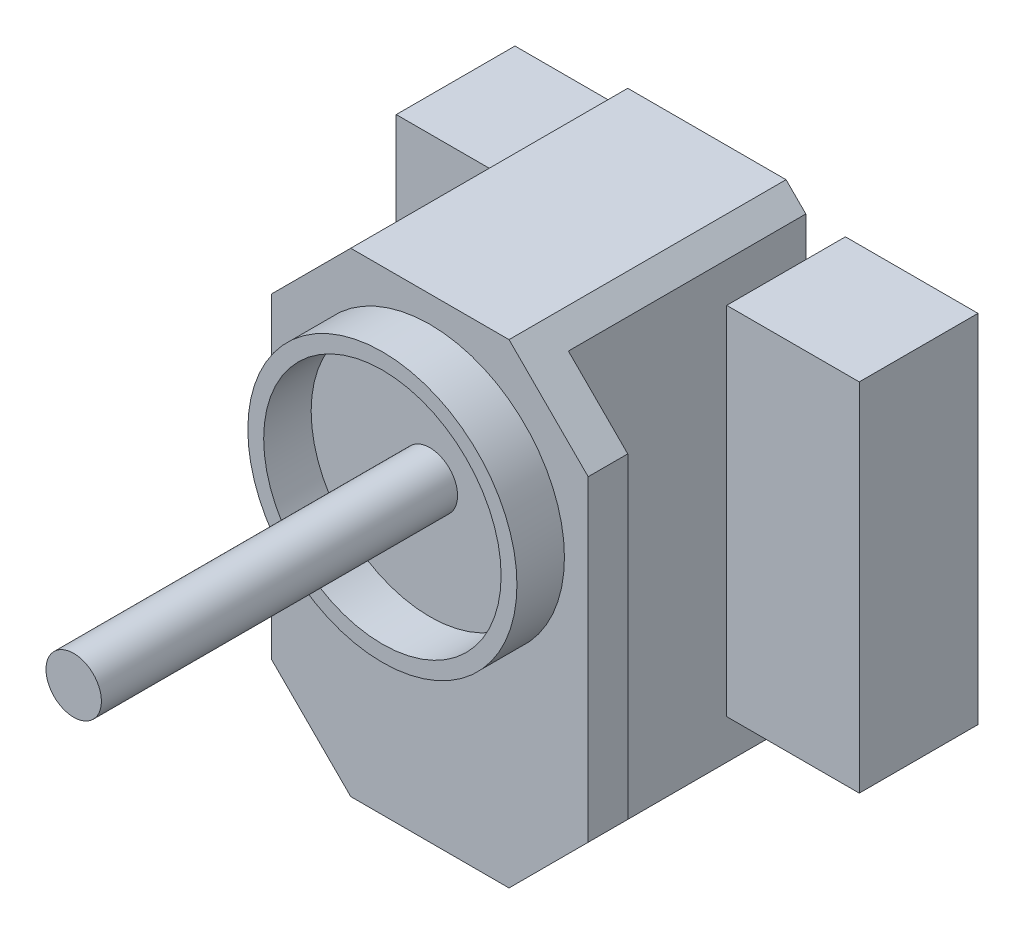
from build123d import *

# Parameters (mm, degrees)
SKETCH_1_W          = 25
SKETCH_1_H          = 60
EXTRUDE_1_DEPTH     = 35
SKETCH_2_W          = 20
SKETCH_2_H          = 40.5
CUT_EXTRUDE_1_DEPTH = 31.5
SKETCH_5_W          = 40
SKETCH_5_H          = 60
EXTRUDE_4_DEPTH     = 5
SKETCH_6_R          = 1.65
CUT_EXTRUDE_2_DEPTH = 6
SKETCH_10_W         = 15
SKETCH_10_H         = 45
EXTRUDE_7_DEPTH     = 16.75
SKETCH_18_R         = 1.25
CUT_EXTRUDE_4_DEPTH = 5
CUT_EXTRUDE_START   = -4
SKETCH_17_R         = 1.65
CUT_EXTRUDE_3_DEPTH = 12
SKETCH_13_R         = 3.5
EXTRUDE_10_DEPTH    = 45
SKETCH_15_R         = 17
SKETCH_15_R_2       = 15
EXTRUDE_11_DEPTH    = 6
CHAMFER_START       = 30
CHAMFER_3_DEPTH     = 5
CHAMFER_START_2     = -1
CHAMFER_3_2_DEPTH   = 31


with BuildPart() as part:
    # 草圖1 → 填料-伸長1 (new body)
    with BuildSketch(Plane.XY):
        Rectangle(SKETCH_1_W, SKETCH_1_H)
    extrude(amount=EXTRUDE_1_DEPTH)

    # 草圖2 → 除料-伸長1 (cut)
    with BuildSketch(Plane(origin=(0, 0, 0), x_dir=(-1, 0, 0), z_dir=(0, 0, -1))):
        Rectangle(SKETCH_2_W, SKETCH_2_H)
    extrude(amount=-CUT_EXTRUDE_1_DEPTH, mode=Mode.SUBTRACT)

    # 草圖5 → 填料-伸長4 (add)
    with BuildSketch(Plane.XY.offset(35)):
        Rectangle(SKETCH_5_W, SKETCH_5_H)
    extrude(amount=-EXTRUDE_4_DEPTH)

    # 草圖6 → 除料-伸長2 (cut)
    with BuildSketch(Plane(origin=(0, 0, 0), x_dir=(-1, 0, 0), z_dir=(0, 0, -1))):
        with Locations((5, 24.75)):
            Circle(SKETCH_6_R)
        with Locations((-5, 24.75)):
            Circle(SKETCH_6_R)
        with Locations((-5, -24.75)):
            Circle(SKETCH_6_R)
        with Locations((5, -24.75)):
            Circle(SKETCH_6_R)
    extrude(amount=-CUT_EXTRUDE_2_DEPTH, mode=Mode.SUBTRACT)

    # 草圖10 → 填料-伸長7 (add)
    with BuildSketch(Plane.ZY.offset(12.5)):
        with Locations((2.5, 0)):
            Rectangle(SKETCH_10_W, SKETCH_10_H)
    extrude_7 = extrude(amount=EXTRUDE_7_DEPTH)

    # 草圖18 → 除料-伸長4 (cut)
    with BuildSketch(Plane(origin=(0, 0, -5), x_dir=(-1, 0, 0), z_dir=(0, 0, -1))):
        with Locations((16, -20)):
            Circle(SKETCH_18_R)
        with Locations((16, 20)):
            Circle(SKETCH_18_R)
    cut_extrude_4 = extrude(amount=-CUT_EXTRUDE_4_DEPTH, mode=Mode.SUBTRACT)

    # 草圖17 → 除料-伸長3 (cut)
    with BuildSketch(Plane(origin=(0, 0, 0), x_dir=(-1, 0, 0), z_dir=(0, 0, -1)).offset(CUT_EXTRUDE_START)):
        with Locations(Location((24.25, 0, 0), (0, 0, 180))):
            Circle(SKETCH_17_R)
        with Locations(Location((24.25, -15, 0), (0, 0, 180))):
            Circle(SKETCH_17_R)
        with Locations(Location((24.25, 15, 0), (0, 0, 180))):
            Circle(SKETCH_17_R)
    cut_extrude_3 = extrude(amount=CUT_EXTRUDE_3_DEPTH, mode=Mode.SUBTRACT)

    # 鏡射1: 填料-伸長7, 除料-伸長4, 除料-伸長3 across plane
    add(extrude_7.mirror(Plane(origin=(0, 0, 0), x_dir=(0, 0, 1), z_dir=(1, 0, 0))))
    add(cut_extrude_4.mirror(Plane(origin=(0, 0, 0), x_dir=(0, 0, 1), z_dir=(1, 0, 0))), mode=Mode.SUBTRACT)
    add(cut_extrude_3.mirror(Plane(origin=(0, 0, 0), x_dir=(0, 0, 1), z_dir=(1, 0, 0))), mode=Mode.SUBTRACT)

    # 草圖13 → 填料-伸長10 (add)
    with BuildSketch(Plane.XY.offset(35)):
        with Locations(Location((0, 9.675, 0), (0, 0, 180))):
            Circle(SKETCH_13_R)
    extrude(amount=EXTRUDE_10_DEPTH)

    # 草圖15 → 填料-伸長11 (add)
    with BuildSketch(Plane.XY.offset(35)):
        with Locations(Location((0, 9.675, 0), (0, 0, 180))):
            Circle(SKETCH_15_R)
        with Locations((0, 9.675)):
            Circle(SKETCH_15_R_2, mode=Mode.SUBTRACT)
    extrude(amount=EXTRUDE_11_DEPTH)

    # 導角3: read off the stored shape, not the designer's step
    # 導角3 outline → 導角3 (cut)
    with BuildSketch(Plane.XY.offset(CHAMFER_START)):
        Polygon((20, 20), (20, 30), (10, 30), align=None)
        Polygon((20, -30), (20, -20), (10, -30), align=None)
        Polygon((-10, 30), (-20, 30), (-20, 20), align=None)
        Polygon((-10, -30), (-20, -20), (-20, -30), align=None)
    extrude(amount=CHAMFER_3_DEPTH, mode=Mode.SUBTRACT)

    # Chamfer 3 2 outline → Chamfer 3 2 (cut)
    with BuildSketch(Plane.XY.offset(CHAMFER_START_2)):
        Polygon((10, 30), (12.5, 27.5), (12.5, 30), align=None)
        Polygon((12.5, -30), (12.5, -27.5), (10, -30), align=None)
        Polygon((-12.5, 27.5), (-10, 30), (-12.5, 30), align=None)
        Polygon((-12.5, -30), (-10, -30), (-12.5, -27.5), align=None)
    extrude(amount=CHAMFER_3_2_DEPTH, mode=Mode.SUBTRACT)


solid = part.part
